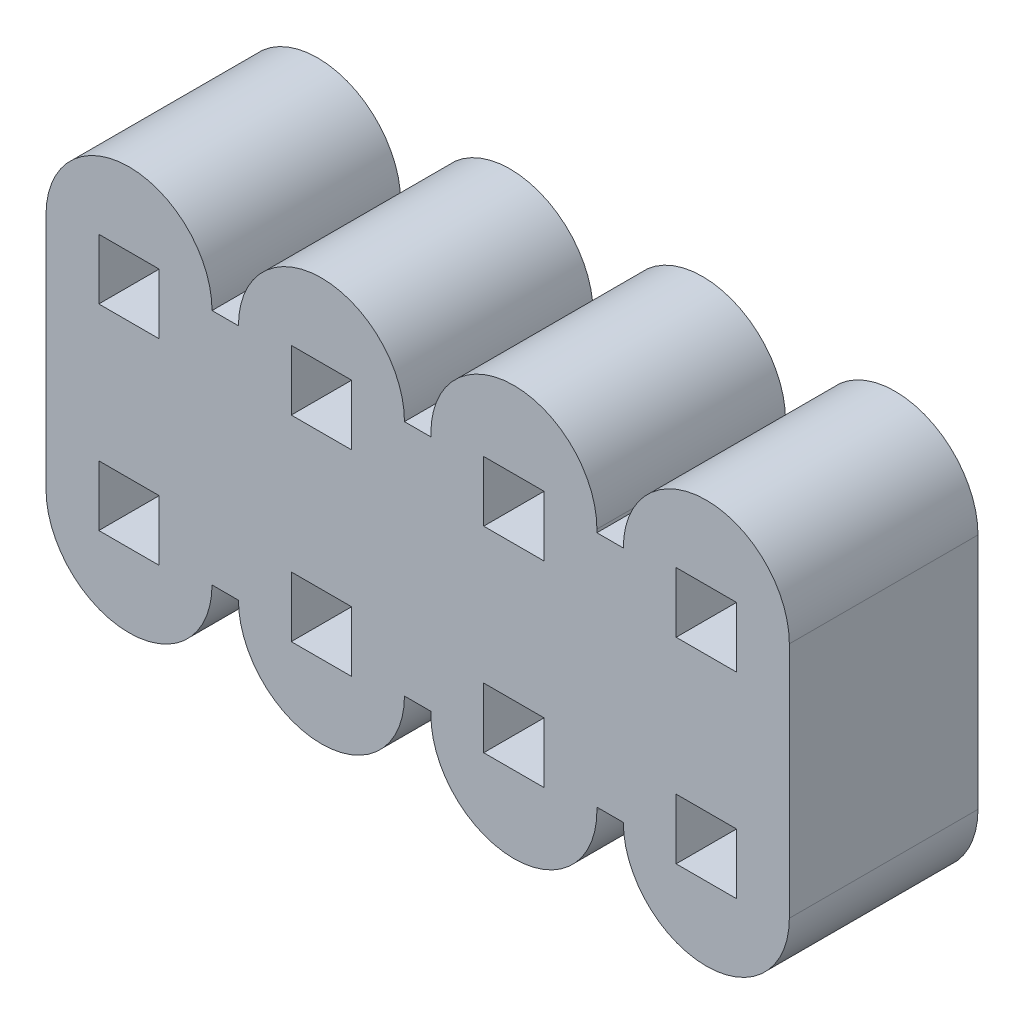
from build123d import *

# Parameters (mm, degrees)
P_IDAT_VYSUNUT_M2_DEPTH  = 2.5
SKICA3_W                 = 0.8
SKICA3_H                 = 0.8
ODEBRAT_VYSUNUT_M1_DEPTH = 2.5
SKICA4_W                 = 8.539651134
SKICA4_H                 = 7.495504433
ODEBRAT_VYSUNUT_M2_DEPTH = 2.5


# Read off the part's stored shape, not the designer's step: Přidat vysunutím2
with BuildPart() as part:
    # Přidat vysunutím2 outline → Přidat vysunutím2 (new body)
    with BuildSketch(Plane.XY):
        with BuildLine():
            Line((2.40336004, -19.590083306), (2.40336004, -16.441317707))
            ThreePointArc((2.40336004, -16.441317707), (1.30336004, -15.341317707), (0.20336004, -16.441317707))
            Line((0.20336004, -16.441317707), (-0.14663996, -16.441317707))
            ThreePointArc((-0.14663996, -16.441317707), (-1.24602276, -15.34131788), (-2.346639267, -16.440083307))
            Line((-2.346639267, -16.440083307), (-2.696640653, -16.440083307))
            ThreePointArc((-2.696640653, -16.440083307), (-3.79725716, -15.34131788), (-4.89663996, -16.441317707))
            Line((-4.89663996, -16.441317707), (-5.24663996, -16.441317707))
            ThreePointArc((-5.24663996, -16.441317707), (-6.34663996, -15.341317707), (-7.44663996, -16.441317707))
            Line((-7.44663996, -16.441317707), (-7.79663996, -16.441317707))
            Line((-7.79663996, -16.441317707), (-7.79663996, -16.399925636))
            ThreePointArc((-7.79663996, -16.399925636), (-8.89663996, -15.299925636), (-9.99663996, -16.399925636))
            Line((-9.99663996, -16.399925636), (-9.99663996, -16.441317707))
            Line((-9.99663996, -16.441317707), (-10.34663996, -16.441317707))
            ThreePointArc((-10.34663996, -16.441317707), (-11.44663996, -15.341317707), (-12.54663996, -16.441317707))
            Line((-12.54663996, -16.441317707), (-12.89663996, -16.441317707))
            ThreePointArc((-12.89663996, -16.441317707), (-13.99663996, -15.341317707), (-15.09663996, -16.441317707))
            Line((-15.09663996, -16.441317707), (-15.09663996, -19.590083306))
            ThreePointArc((-15.09663996, -19.590083306), (-13.99663996, -20.690083306), (-12.89663996, -19.590083306))
            Line((-12.89663996, -19.590083306), (-12.54663996, -19.590083306))
            ThreePointArc((-12.54663996, -19.590083306), (-11.44663996, -20.690083306), (-10.34663996, -19.590083306))
            Line((-10.34663996, -19.590083306), (-9.99663996, -19.590083306))
            Line((-9.99663996, -19.590083306), (-9.99663996, -19.631475378))
            ThreePointArc((-9.99663996, -19.631475378), (-8.89663996, -20.731475378), (-7.79663996, -19.631475378))
            Line((-7.79663996, -19.631475378), (-7.79663996, -19.590083306))
            Line((-7.79663996, -19.590083306), (-7.44663996, -19.590083306))
            ThreePointArc((-7.44663996, -19.590083306), (-6.34663996, -20.690083306), (-5.24663996, -19.590083306))
            Line((-5.24663996, -19.590083306), (-4.89663996, -19.590083306))
            ThreePointArc((-4.89663996, -19.590083306), (-3.79663996, -20.690083306), (-2.69663996, -19.590083306))
            Line((-2.69663996, -19.590083306), (-2.34663996, -19.590083306))
            ThreePointArc((-2.34663996, -19.590083306), (-1.24663996, -20.690083306), (-0.14663996, -19.590083306))
            Line((-0.14663996, -19.590083306), (0.20336004, -19.590083306))
            ThreePointArc((0.20336004, -19.590083306), (1.30336004, -20.690083306), (2.40336004, -19.590083306))
        make_face()
    extrude(amount=P_IDAT_VYSUNUT_M2_DEPTH)

    # Skica3 → Odebrat vysunutím1 (cut)
    with BuildSketch(Plane.XY.offset(2.5)):
        with Locations((-13.99663996, -16.715700507)):
            Rectangle(SKICA3_W, SKICA3_H)
        with Locations((-13.99663996, -19.315700507)):
            Rectangle(SKICA3_W, SKICA3_H)
        with Locations((-8.89663996, -16.715700507)):
            Rectangle(SKICA3_W, SKICA3_H)
        with Locations((-11.44663996, -16.715700507)):
            Rectangle(SKICA3_W, SKICA3_H)
        with Locations((-11.44663996, -19.315700507)):
            Rectangle(SKICA3_W, SKICA3_H)
        with Locations((-8.89663996, -19.315700507)):
            Rectangle(SKICA3_W, SKICA3_H)
        with Locations((-6.34663996, -16.715700507)):
            Rectangle(SKICA3_W, SKICA3_H)
        with Locations((-6.34663996, -19.315700507)):
            Rectangle(SKICA3_W, SKICA3_H)
        with Locations((-3.79663996, -16.715700507)):
            Rectangle(SKICA3_W, SKICA3_H)
        with Locations((-3.79663996, -19.315700507)):
            Rectangle(SKICA3_W, SKICA3_H)
        with Locations((-1.24663996, -16.715700507)):
            Rectangle(SKICA3_W, SKICA3_H)
        with Locations((-1.24663996, -19.315700507)):
            Rectangle(SKICA3_W, SKICA3_H)
        with Locations((1.30336004, -16.715700507)):
            Rectangle(SKICA3_W, SKICA3_H)
        with Locations((1.30336004, -19.315700507)):
            Rectangle(SKICA3_W, SKICA3_H)
    extrude(amount=-ODEBRAT_VYSUNUT_M1_DEPTH, mode=Mode.SUBTRACT)

    # Skica4 → Odebrat vysunutím2 (cut)
    with BuildSketch(Plane.XY.offset(2.5)):
        with Locations((-0.976814393, -18.745431106)):
            Rectangle(SKICA4_W, SKICA4_H)
    extrude(amount=-ODEBRAT_VYSUNUT_M2_DEPTH, mode=Mode.SUBTRACT)


solid = part.part
